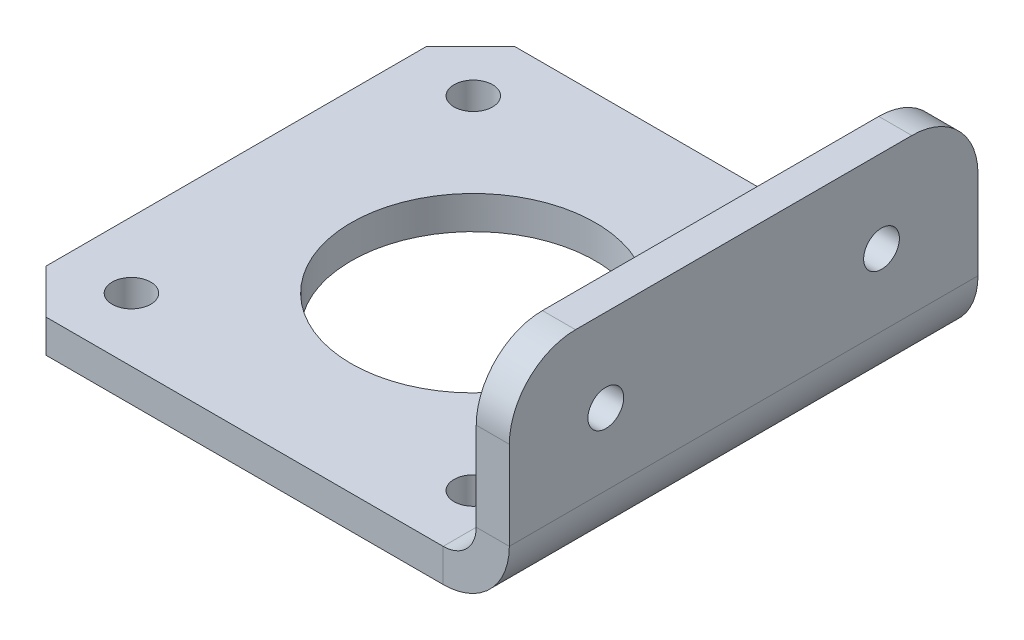
from build123d import *

# Parameters (mm, degrees)
BOSS_EXTRUDE1_DEPTH        = 3
M3_CLEARANCE_HOLE1_D       = 3.242
F_3_5_3_5_DIAMETER_HOLE1_D = 3.5
SKETCH14_R                 = 11.075
CUT_EXTRUDE1_DEPTH         = 50.404579747
SKETCHED_START             = 0.899268265
SKETCHED_BEND1_OUTLINE_W   = 3
SKETCHED_BEND1_OUTLINE_H   = 42.5
SKETCHED_BEND1_DEPTH       = 15.700731735
SKETCHED_START_2           = -1.484291735
SKETCHED_BEND1_2_OUTLINE_R = 1.621
SKETCHED_BEND1_2_DEPTH     = 0.01644
SKETCHED_START_3           = -4.484291735
SKETCHED_BEND1_3_OUTLINE_R = 1.621
SKETCHED_BEND1_3_DEPTH     = 6
SKETCHED_START_4           = -21.25
SKETCHED_BEND1_4_DEPTH     = 42.5


with BuildPart() as part:
    # Sketch7 → Boss-Extrude1 (new body)
    with BuildSketch(Plane(origin=(0, 0, 0), x_dir=(1, 0, 0), z_dir=(0, 1, 0))):
        with BuildLine():
            Line((-40.5, -21.25), (10.6, -21.25))
            ThreePointArc((10.6, -21.25), (14.842640687, -19.492640687), (16.6, -15.25))
            Line((16.6, -15.25), (16.6, 15.25))
            ThreePointArc((16.6, 15.25), (14.842640687, 19.492640687), (10.6, 21.25))
            Line((10.6, 21.25), (-40.5, 21.25))
            Line((-40.5, 21.25), (-44.5, 17.25))
            Line((-44.5, 17.25), (-44.5, -17.25))
            Line((-44.5, -17.25), (-40.5, -21.25))
        make_face()
    extrude(amount=-BOSS_EXTRUDE1_DEPTH)

    # M3 Clearance Hole1 (through all)
    with Locations(Plane(origin=(0, -3, 0), x_dir=(-1, 0, 0), z_dir=(0, -1, 0))):
        with Locations((-9.084084573, -12.5), (-9.084084573, 12.5)):
            Hole(M3_CLEARANCE_HOLE1_D / 2)

    # Ø3.5 (3.5) Diameter Hole1 (through all)
    with Locations(Plane(origin=(0, 0, 0), x_dir=(1, 0, 0), z_dir=(0, 1, 0))):
        with Locations((-7.5, -15.5), (-38.5, -15.5), (-38.5, 15.5), (-7.5, 15.5)):
            Hole(F_3_5_3_5_DIAMETER_HOLE1_D / 2)

    # Sketch14 → Cut-Extrude1 (cut, through all)
    with BuildSketch(Plane.XZ.offset(3)):
        with Locations(Location((-23, 0, 0), (0, 0, 90))):
            Circle(SKETCH14_R)
    extrude(amount=-CUT_EXTRUDE1_DEPTH, mode=Mode.SUBTRACT)

    # Sketched Bend1: read off the stored shape, not the designer's step
    # Sketched Bend1 outline → Sketched Bend1 (cut)
    with BuildSketch(Plane.YZ.offset(SKETCHED_START)):
        with Locations((-1.5, 0)):
            Rectangle(SKETCHED_BEND1_OUTLINE_W, SKETCHED_BEND1_OUTLINE_H)
    extrude(amount=SKETCHED_BEND1_DEPTH, mode=Mode.SUBTRACT)

    # Sketched Bend1 2 outline → Sketched Bend1 2 (add)
    with BuildSketch(Plane.YZ.offset(SKETCHED_START_2)):
        with BuildLine():
            Line((0, -21.25), (11.015708265, -21.25))
            ThreePointArc((11.015708265, -21.25), (15.258348952, -19.492640687), (17.015708265, -15.25))
            Line((17.015708265, -15.25), (17.015708265, 15.25))
            ThreePointArc((17.015708265, 15.25), (15.258348952, 19.492640687), (11.015708265, 21.25))
            Line((11.015708265, 21.25), (0, 21.25))
            Line((0, 21.25), (0, -21.25))
        make_face()
        with Locations((9.499792838, -12.5)):
            Circle(SKETCHED_BEND1_2_OUTLINE_R, mode=Mode.SUBTRACT)
        with Locations((9.499792838, 12.5)):
            Circle(SKETCHED_BEND1_2_OUTLINE_R, mode=Mode.SUBTRACT)
    extrude(amount=SKETCHED_BEND1_2_DEPTH)

    # Sketched Bend1 3 outline → Sketched Bend1 3 (add)
    with BuildSketch(Plane.YZ.offset(SKETCHED_START_3)):
        with BuildLine():
            Line((0, -21.25), (11.015708265, -21.25))
            ThreePointArc((11.015708265, -21.25), (15.258348952, -19.492640687), (17.015708265, -15.25))
            Line((17.015708265, -15.25), (17.015708265, 15.25))
            ThreePointArc((17.015708265, 15.25), (15.258348952, 19.492640687), (11.015708265, 21.25))
            Line((11.015708265, 21.25), (0, 21.25))
            Line((0, 21.25), (0, -21.25))
        make_face()
        with Locations((9.499792838, -12.5)):
            Circle(SKETCHED_BEND1_3_OUTLINE_R, mode=Mode.SUBTRACT)
        with Locations((9.499792838, 12.5)):
            Circle(SKETCHED_BEND1_3_OUTLINE_R, mode=Mode.SUBTRACT)
    extrude(amount=SKETCHED_BEND1_3_DEPTH)

    # Sketched Bend1 4 outline → Sketched Bend1 4 (cut)
    with BuildSketch(Plane.XY.offset(SKETCHED_START_4)):
        with BuildLine():
            Line((-1.484291735, 3), (-1.484291735, 17.015708265))
            Line((-1.484291735, 17.015708265), (-4.484291735, 17.015708265))
            Line((-4.484291735, 17.015708265), (-4.484291735, 0))
            ThreePointArc((-4.484291735, 0), (-2.362971392, 0.878679656), (-1.484291735, 3))
        make_face()
        with BuildLine():
            Line((1.515708265, 0), (1.515708265, 3))
            ThreePointArc((1.515708265, 3), (-0.241651048, -1.242640687), (-4.484291735, -3))
            Line((-4.484291735, -3), (0.899268265, -3))
            Line((0.899268265, -3), (0.899268265, 0))
            Line((0.899268265, 0), (1.515708265, 0))
        make_face()
    extrude(amount=SKETCHED_BEND1_4_DEPTH, mode=Mode.SUBTRACT)


solid = part.part
